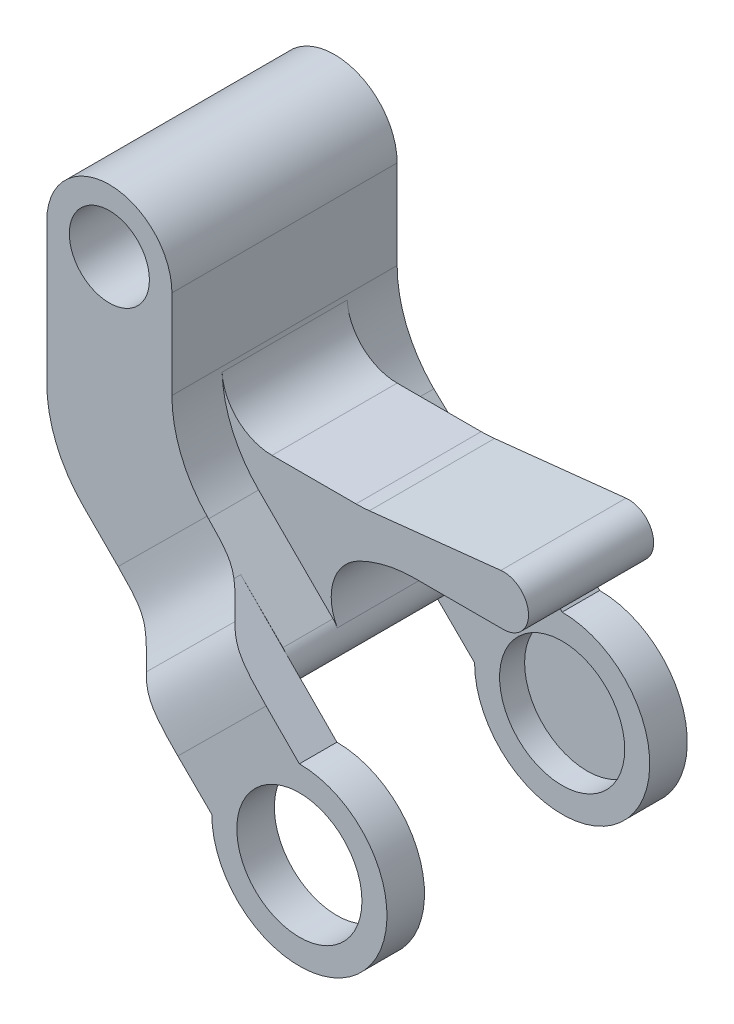
from build123d import *

# Parameters (mm, degrees)
SKETCH1_R           = 1.6
SKETCH1_R_2         = 2.4999999999999964
BOSS_EXTRUDE1_DEPTH = 4.5
SKETCH3_R           = 4.750000000000001
CUT_EXTRUDE1_DEPTH  = 9
BOSS_EXTRUDE2_START = 1.5
SKETCH4_R           = 3.4999999999999996
SKETCH4_R_2         = 2.5000000000000018
BOSS_EXTRUDE2_DEPTH = 1.5
FILLET1_START       = -8.126082892
FILLET1_DEPTH       = 5.963451672
FILLET3_R           = 1
SKETCH5_R           = 2.5000000000000018
BOSS_EXTRUDE3_DEPTH = 0.5
BOSS_EXTRUDE4_DEPTH = 2.5
FILLET4_R           = 5
FILLET5_R           = 2
FILLET6_R           = 5


with BuildPart() as part:
    # Sketch1 → Boss-Extrude1 (new, symmetric)
    with BuildSketch(Plane.XY):
        with BuildLine():
            Line((-2.5, 0), (-2.499999999999999, -7.6922671661961415))
            Line((-2.499999999999999, -7.6922671661961415), (5.59344897920139, -15.785716145397497))
            ThreePointArc((5.59344897920139, -15.785716145397497), (11.568140473889555, -18.224873734152915), (9.128982885134128, -12.250182239464754))
            Line((9.128982885134128, -12.250182239464754), (2.500000000000001, -5.621199354330655))
            Line((2.500000000000001, -5.621199354330655), (2.5, 0))
            ThreePointArc((2.5, 0), (1.5e-16, 2.5), (-2.5, 0))
        make_face()
        Circle(SKETCH1_R, mode=Mode.SUBTRACT)
        with Locations((9.093266739736636, -15.75)):
            Circle(SKETCH1_R_2, mode=Mode.SUBTRACT)
    extrude(amount=BOSS_EXTRUDE1_DEPTH, both=True)

    # Sketch3 → Cut-Extrude1 (cut)
    with BuildSketch(Plane.XY.offset(4.5)):
        with Locations((9.093266739736636, -15.75)):
            Circle(SKETCH3_R)
    extrude(amount=-CUT_EXTRUDE1_DEPTH, mode=Mode.SUBTRACT)

    # Sketch4 → Boss-Extrude2 (add)
    # profile 1 of 3: a face of its own
    with BuildSketch(Plane.XY.offset(4.5).offset(BOSS_EXTRUDE2_START)):
        with BuildLine():
            ThreePointArc((4.4744473247851495, -14.641394023077986), (5.734522129252316, -12.391230189259387), (7.98469541716161, -11.131172267472593))
            Line((7.9846954171615945, -11.13117226747262), (5.252559389002018, -8.37375874333266))
            Line((5.252559389002018, -8.37375874333266), (1.700745560054771, -11.89301272625091))
            Line((1.7007455600547712, -11.89301272625091), (4.474447324785227, -14.641394023077948))
        make_face()
    # profile 2 of 3: a face of its own
    with BuildSketch(Plane.XY.offset(4.5).offset(BOSS_EXTRUDE2_START)):
        with BuildLine():
            ThreePointArc((5.593266739736636, -15.75), (6.61839300558372, -13.275126265847083), (9.093266739736636, -12.25))
            Line((9.093266739736636, -12.25), (7.9846954171615945, -11.13117226747262))
            ThreePointArc((7.98469541716161, -11.131172267472593), (5.734522129252316, -12.391230189259387), (4.4744473247851495, -14.641394023077986))
            Line((4.474447324785227, -14.641394023077948), (5.593266739736636, -15.75))
        make_face()
    # profile 3 of 3: a face of its own
    with BuildSketch(Plane.XY.offset(4.5).offset(BOSS_EXTRUDE2_START)):
        with Locations((9.093266739736636, -15.75)):
            Circle(SKETCH4_R)
        with Locations((9.093266739736636, -15.75)):
            Circle(SKETCH4_R_2, mode=Mode.SUBTRACT)
    boss_extrude2 = extrude(amount=-BOSS_EXTRUDE2_DEPTH)

    # Mirror1: Boss-Extrude2 across plane
    add(boss_extrude2.mirror(Plane.XY))

    # Fillet1: read off the stored shape, not the designer's step
    # Fillet1 outline → Fillet1 (cut)
    with BuildSketch(Plane(origin=(0, 0, 0), x_dir=(0.7038433348722607, -0.7103552350450406, 0), z_dir=(0.7103552350450406, 0.7038433348722604, 0)).offset(FILLET1_START)):
        with BuildLine():
            Line((9.645322277, 6), (9.645322277, 4.5))
            add(Edge.make_bspline(
                [(9.645322277, 4.5), (11.115616365533654, 6.000000000002685), (13.216036492, 6)],
                knots=[0, 0, 0, 1, 1, 1], degree=2, weights=[1, 2.30488611432322, 1]))
            Line((13.216036492, 6), (9.645322277, 6))
        make_face()
        with BuildLine():
            add(Edge.make_bspline(
                [(9.645322277, -4.5), (11.115616365534704, -5.999999999999404), (13.216036492, -6)],
                knots=[0, 0, 0, 1, 1, 1], degree=2, weights=[1, 2.30488611432322, 1]))
            Line((9.645322277, -4.5), (9.645322277, -6))
            Line((9.645322277, -6), (13.216036492, -6))
        make_face()
    extrude(amount=FILLET1_DEPTH, mode=Mode.SUBTRACT)

    # Fillet2
    # a fillet whose section is not a circle: 5 mm, written as the material it adds along each edge (its section moved 0.00015 mm through the faces so that the kernel can cut it)
    with BuildSketch(Plane(origin=(5.252559389002018, -8.37375874333266, -4.5), x_dir=(-0.7038433326996095, 0.7103552328501724, 7.859188268463715e-05), z_dir=(-0.7103552350439925, -0.7038433348733185, 0))) as fillet2_piece_1_section:
        with BuildLine():
            Bezier((1.9085940541919586, 0), (0.25927433920384835, -0.00012962314195013), (-1.0664365698179072, 0.9810666491436392), weights=[1, 2.3741747222401877, 1])
            Line((-1.0664365698179072, 0.9810666491436392), (-1.1259275381450011, 0.9006873938130198))
            ThreePointArc((-1.1259275381450011, 0.9006873938130198), (-0.5842679506665102, 0.43645084882092705), (-0.07140878262543363, -0.07000561237467808))
            Line((-0.07140878262543363, -0.07000561237467808), (7.85918826802e-06, -0.09999999969116545))
            ThreePointArc((7.85918826802e-06, -0.09999999969116545), (0.9543048803898561, -0.09992499969139726), (1.9086019133802261, -0.09999999969116545))
            Line((1.9086019133802261, -0.09999999969116545), (1.9085940541919586, 0))
        make_face()
    fillet2_piece_1 = extrude(amount=9.771538142377612, mode=Mode.PRIVATE)
    fillet2_piece_1 = split(fillet2_piece_1, bisect_by=Plane(origin=(5.252559389002018, -8.37375874333266, -4.5), z_dir=(-0.707106781186546, -0.707106781186549, 0)), keep=Keep.TOP, mode=Mode.PRIVATE)
    fillet2_piece_1 = split(fillet2_piece_1, bisect_by=Plane(origin=(1.7170254830692855, -11.909292649265407, -4.5), z_dir=(0.707106781186546, 0.707106781186549, 0)), keep=Keep.TOP, mode=Mode.PRIVATE)
    fillet2_piece_1 = split(fillet2_piece_1, bisect_by=Plane(origin=(1.7333853025127066, -11.925354508213672, -4.5), z_dir=(0.7038570774376808, 0.7103416181957006, 0)), keep=Keep.TOP, mode=Mode.PRIVATE)
    add(fillet2_piece_1)
    with BuildSketch(Plane(origin=(5.252559389002018, -8.37375874333266, 4.5), x_dir=(-0.7038433326996095, 0.7103552328501724, -7.85918826847737e-05), z_dir=(-0.7103552350439925, -0.7038433348733185, 0))) as fillet2_piece_2_section:
        with BuildLine():
            Bezier((1.9085940541886428, 0), (0.25927433920271037, 0.00012962314195018), (-1.0664365698180711, -0.9810666491413066), weights=[1, 2.374174722240495, 1])
            Line((-1.0664365698180711, -0.9810666491413066), (-1.125927538145101, -0.9006873938106411))
            ThreePointArc((-1.125927538145101, -0.9006873938106411), (-0.5842679506666038, -0.4364508488196), (-0.07140878262533187, 0.0700056123747811))
            Line((-0.07140878262533187, 0.0700056123747811), (7.8591882693e-06, 0.09999999969116545))
            ThreePointArc((7.8591882693e-06, 0.09999999969116545), (0.9543048803881994, 0.09992499969139726), (1.9086019133769117, 0.09999999969116545))
            Line((1.9086019133769117, 0.09999999969116545), (1.9085940541886428, 0))
        make_face()
    fillet2_piece_2 = extrude(amount=9.771538142369321, mode=Mode.PRIVATE)
    fillet2_piece_2 = split(fillet2_piece_2, bisect_by=Plane(origin=(1.7170254830692855, -11.909292649265407, 4.5), z_dir=(0.707106781186546, 0.707106781186549, 0)), keep=Keep.TOP, mode=Mode.PRIVATE)
    fillet2_piece_2 = split(fillet2_piece_2, bisect_by=Plane(origin=(5.252559389002018, -8.37375874333266, 4.5), z_dir=(-0.707106781186546, -0.707106781186549, 0)), keep=Keep.TOP, mode=Mode.PRIVATE)
    fillet2_piece_2 = split(fillet2_piece_2, bisect_by=Plane(origin=(1.7333853025127066, -11.925354508213672, 4.5), z_dir=(0.7038570774376808, 0.7103416181957006, 0)), keep=Keep.TOP, mode=Mode.PRIVATE)
    add(fillet2_piece_2)

    # Fillet3
    # the kernel refuses this fillet: 1 mm, written as the material it takes off along each edge
    with BuildSketch(Plane(origin=(4.4695848720713, -14.661852038267408, -4.5), x_dir=(0.3674872938849202, 0.9300285419454277, 0), z_dir=(0, 0, 1))) as fillet3_piece_1:
        with BuildLine():
            CenterArc((1.5189314922424455, 0.9894814011805907), FILLET3_R, 156.5607354128971, 105.12166531490846)
            Line((0.6014492460298756, 1.3872581323813222), (0, 0))
            ThreePointArc((0, 0), (0.68713567506206, 0.04996334439219424), (1.3742713501241177, -2e-17))
        make_face()
    extrude(amount=9, mode=Mode.SUBTRACT)
    with BuildSketch(Plane(origin=(8.005118778004036, -11.126318132334667, -4.5), x_dir=(-0.7071067811866694, 0.7071067811864257, 0), z_dir=(0, 0, 1))) as fillet3_piece_2:
        with BuildLine():
            CenterArc((1.512027222443001, 1.0000000000000007), FILLET3_R, 164.87833468508381, 105.1216653149063)
            ThreePointArc((0.5466531654354455, 1.2608695652175128), (0.3191670641589702, 0.6105605267965641), (0, 0))
            Line((0, 0), (1.5120272224428286, 4e-17))
        make_face()
    extrude(amount=9, mode=Mode.SUBTRACT)

    # Sketch5 → Boss-Extrude3 (add)
    with BuildSketch(Plane(origin=(0, 0, -6), x_dir=(-1, 0, 0), z_dir=(0, 0, -1))):
        with Locations(Location((-9.093266739736636, -15.75, 0), (0, 0, 180))):
            Circle(SKETCH5_R)
    extrude(amount=-BOSS_EXTRUDE3_DEPTH)

    # Sketch7 → Boss-Extrude4 (add, symmetric)
    with BuildSketch(Plane.XY):
        with BuildLine():
            ThreePointArc((12.834784737336257, -5.621199354330662), (12.912454393011577, -6.570532060599576), (13.749999999999998, -7.024164641901866))
            Line((13.749999999999998, -7.024164641901864), (13.75, -5.621199354330655))
            Line((13.75, -5.621199354330655), (12.834784737336253, -5.621199354330655))
        make_face()
        with BuildLine():
            Line((13.75, -5.621199354330655), (13.749999999999998, -7.024164641901864))
            ThreePointArc((13.749999999999998, -7.024164641901866), (14.457106781186546, -6.731271423088413), (14.75, -6.024164641901864))
            ThreePointArc((14.75, -6.024164641901864), (14.418375906356768, -5.280340974759061), (13.643452704396466, -5.029857006509489))
            ThreePointArc((13.643452704396466, -5.029857006509489), (13.159727923368479, -5.216960283917396), (12.834784737336257, -5.621199354330662))
            Line((12.834784737336253, -5.621199354330655), (13.75, -5.621199354330655))
        make_face()
        with BuildLine():
            Line((6.614639823149787, -7.024164641901864), (8.129576761852361, -7.024164641901864))
            Line((8.129576761852361, -7.024164641901864), (13.75, -7.024164641901864))
            ThreePointArc((13.749999999999998, -7.024164641901866), (12.912454393011577, -6.570532060599576), (12.834784737336257, -5.621199354330662))
            Line((12.834784737336253, -5.621199354330655), (8.125, -5.621199354330655))
            Line((8.125, -5.621199354330655), (2.500000000000001, -5.621199354330655))
            Line((2.500000000000001, -5.621199354330655), (3.9029652875712157, -7.024164641901864))
            Line((3.9029652875712157, -7.024164641901864), (6.614639823149787, -7.024164641901864))
        make_face()
        Polygon((5.252559389002302, -8.373758743332944), (6.0030522403921855, -9.13119509235208), (8.129576761852361, -7.024164641901864), (6.614639823149787, -7.024164641901864), align=None)
        Polygon((3.9029652875712157, -7.024164641901864), (5.252559389002302, -8.373758743332944), (6.614639823149787, -7.024164641901864), align=None)
        with BuildLine():
            Line((8.125, -5.621199354330655), (12.834784737336253, -5.621199354330655))
            ThreePointArc((12.834784737336257, -5.621199354330662), (13.159727923368479, -5.216960283917396), (13.643452704396466, -5.029857006509489))
            Line((13.643452704396466, -5.0298570065094905), (8.125, -5.621199354330655))
        make_face()
    extrude(amount=BOSS_EXTRUDE4_DEPTH, both=True)

    # Fillet4
    fillet4_edges = [part.edges().sort_by_distance(p)[0] for p in [
        (8.125, -5.621199354330655, 0),
        (8.129576761852361, -7.024164641901864, 0),
    ]]
    fillet(fillet4_edges, radius=FILLET4_R)

    # Fillet5
    # the kernel refuses this fillet: 2 mm, written as the material it adds along each edge
    with BuildSketch(Plane(origin=(6.006539975421141, -9.12773932975214, -2.5), x_dir=(0.6887204470321209, -0.7250269966283157, 0), z_dir=(0, 0, 1))) as fillet5_piece_1:
        with BuildLine():
            CenterArc((2.11607805444544, 1.9318531703443815), FILLET5_R, 162.6302604591367, 92.36990753869333)
            Line((0.20728179001408314, 2.5289267176506547), (0.0164021635709476, 2.5886340723812813))
            ThreePointArc((0.0164021635709476, 2.5886340723812813), (-0.21957324686099225, 0.9266827798096786), (-0.19995560376753524, -0.00421384882979087))
            Line((-0.19995560376753524, -0.00421384882979087), (0.005134521484191, -0.19993408085948786))
            ThreePointArc((0.005134521484191, -0.19993408085948786), (1.319091329821553, -0.16619026173425153), (1.5466823860752452, -0.19318531703443798))
            Line((1.5466823860752452, -0.19318531703443798), (1.5984456286543542, -7e-17))
        make_face()
    extrude(amount=5)
    with BuildSketch(Plane(origin=(2.500000000000001, -5.621199354330655, 2.5), x_dir=(1, 0, 0), z_dir=(0, 0, -1))) as fillet5_piece_2:
        with BuildLine():
            CenterArc((FILLET5_R, -FILLET5_R), FILLET5_R, 90, 90)
            Line((-8.9e-16, -FILLET5_R), (0, 0))
            Line((0, 0), (FILLET5_R, 0))
        make_face()
    extrude(amount=5)

    # Fillet6
    # the kernel refuses this fillet: 5 mm, written as the material it adds along each edge
    with BuildSketch(Plane(origin=(2.500000000000001, -5.621199354330655, 4.5), x_dir=(-4.3e-16, 1, 0), z_dir=(0, 0, -1)), Plane(origin=(2.500000000000001, -5.621199354330655, 2.677669529663687), x_dir=(-4.3e-16, 1, 0), z_dir=(0, 0, -1))) as fillet6_piece_1:
        with BuildLine():
            CenterArc((FILLET6_R * 0.414213562373, FILLET6_R), FILLET6_R, 225.00000000000003, 45)
            Line((-FILLET6_R * 0.292893218813, FILLET6_R * 0.292893218813), (0, 0))
            Line((0, 0), (FILLET6_R * 0.414213562373, 0))
        make_face()
    extrude(amount=7.177669529663687)
    # the kernel refuses this fillet: 5 mm, written as the material it takes off along each edge
    with BuildSketch(Plane(origin=(-2.499999999999999, -7.6922671661961415, -9.677669529663689), x_dir=(-2.1e-16, 1, 0), z_dir=(0, 0, 1))) as fillet6_2_piece_1:
        with BuildLine():
            CenterArc((FILLET6_R * 0.414213562373, -FILLET6_R), FILLET6_R, 90, 45)
            Line((-FILLET6_R * 0.292893218813, -FILLET6_R * 0.292893218813), (0, 0))
            Line((0, 0), (FILLET6_R * 0.414213562373, 0))
        make_face()
    extrude(amount=19.355339059327378, mode=Mode.SUBTRACT)


solid = part.part
